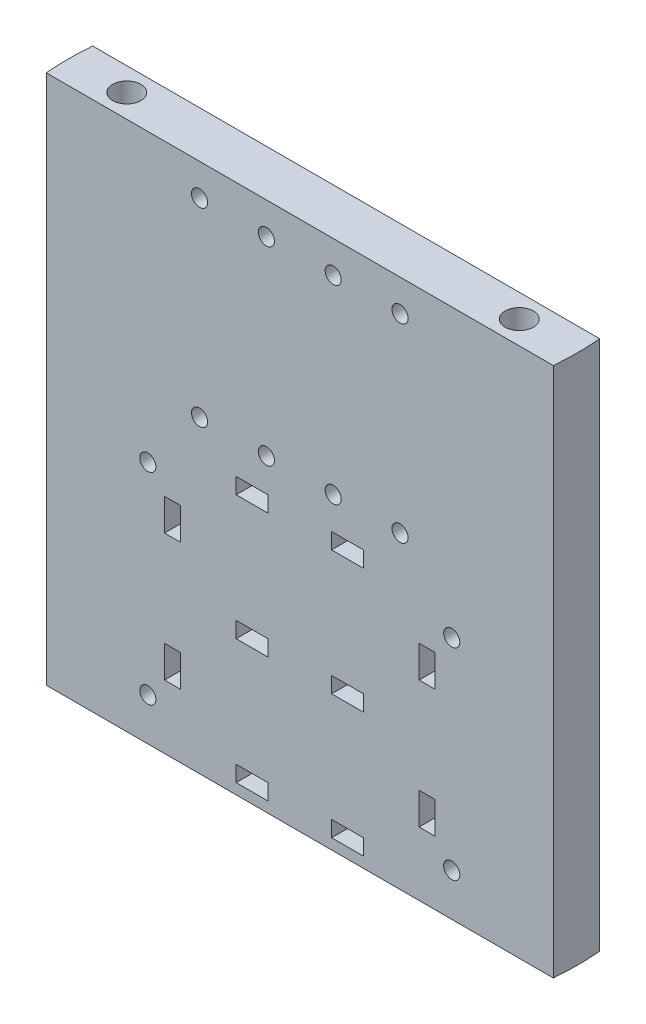
from build123d import *

# Parameters (mm, degrees)
BOSS_EXTRUDE1_DEPTH           = 127
TAP_DRILL_FOR_1_4_HELICOIL1_D = 6.7564
F_8_CLEARANCE_HOLE1_D         = 3.8608
SKETCH19_W                    = 7.62
SKETCH19_H                    = 3.81
SKETCH19_W_2                  = 3.81
SKETCH19_H_2                  = 7.62
CUT_EXTRUDE3_DEPTH            = 142.310771904
F_8_CLEARANCE_HOLE2_D         = 3.8608
F_8_CLEARANCE_HOLE3_D         = 3.8608
SKETCH10_W                    = 64.77
SKETCH10_H                    = 63.5
CUT_EXTRUDE4_DEPTH            = 5.08


with BuildPart() as part:
    # Sketch1 → Boss-Extrude1 (new body)
    with BuildSketch(Plane(origin=(0, 0, 0), x_dir=(1, 0, 0), z_dir=(0, 1, 0))):
        with BuildLine():
            Line((60.706, 5.559061432), (-60.706, 5.559061432))
            ThreePointArc((-60.706, 5.559061432), (-60.96, 0), (-60.706, -5.559061432))
            Line((-60.706, -5.559061432), (60.706, -5.559061432))
            ThreePointArc((60.706, -5.559061432), (60.96, 0), (60.706, 5.559061432))
        make_face()
    extrude(amount=BOSS_EXTRUDE1_DEPTH)

    # Tap Drill for 1/4 Helicoil1 (through all)
    with Locations(Plane(origin=(0, 127, 0), x_dir=(1, 0, 0), z_dir=(0, 1, 0))):
        with Locations((-46.99, 0), (46.99, 0)):
            Hole(TAP_DRILL_FOR_1_4_HELICOIL1_D / 2)

    # #8 Clearance Hole1 (through all)
    with Locations(Plane(origin=(0, 0, -5.559061432), x_dir=(-1, 0, 0), z_dir=(0, 0, -1))):
        with Locations((-8.001, 119.38), (-8.001, 73.914), (8.001, 73.914), (8.001, 119.38)):
            Hole(F_8_CLEARANCE_HOLE1_D / 2)

    # Sketch19 → Cut-Extrude3 (cut, through all)
    with BuildSketch(Plane(origin=(0, 0, -5.559061432), x_dir=(-1, 0, 0), z_dir=(0, 0, -1))):
        with Locations((-11.43, 34.29)):
            Rectangle(SKETCH19_W, SKETCH19_H)
        with Locations((30.48, 49.53)):
            Rectangle(SKETCH19_W_2, SKETCH19_H_2)
        with Locations((-11.43, 64.135)):
            Rectangle(SKETCH19_W, SKETCH19_H)
        with Locations((11.43, 64.135)):
            Rectangle(SKETCH19_W, SKETCH19_H)
        with Locations((-11.43, 4.445)):
            Rectangle(SKETCH19_W, SKETCH19_H)
        with Locations((11.43, 4.445)):
            Rectangle(SKETCH19_W, SKETCH19_H)
        with Locations((-30.48, 49.53)):
            Rectangle(SKETCH19_W_2, SKETCH19_H_2)
        with Locations((30.48, 19.05)):
            Rectangle(SKETCH19_W_2, SKETCH19_H_2)
        with Locations((-30.48, 19.05)):
            Rectangle(SKETCH19_W_2, SKETCH19_H_2)
        with Locations((11.43, 34.29)):
            Rectangle(SKETCH19_W, SKETCH19_H)
    extrude(amount=-CUT_EXTRUDE3_DEPTH, mode=Mode.SUBTRACT)

    # #8 Clearance Hole2 (through all)
    with Locations(Plane(origin=(0, 0, -5.559061432), x_dir=(-1, 0, 0), z_dir=(0, 0, -1))):
        with Locations((-24.003, 119.38), (-24.003, 73.914), (24.003, 73.914), (24.003, 119.38)):
            Hole(F_8_CLEARANCE_HOLE2_D / 2)

    # #8 Clearance Hole3 (through all)
    with Locations(Plane(origin=(0, 0, -5.559061432), x_dir=(-1, 0, 0), z_dir=(0, 0, -1))):
        with Locations((-36.3855, 58.42), (-36.3855, 10.16), (36.3855, 10.16), (36.3855, 58.42)):
            Hole(F_8_CLEARANCE_HOLE3_D / 2)

    # Sketch10 → Cut-Extrude4 (cut)
    with BuildSketch(Plane(origin=(0, 0, -5.559061432), x_dir=(-1, 0, 0), z_dir=(0, 0, -1))):
        with Locations((0, 34.29)):
            Rectangle(SKETCH10_W, SKETCH10_H)
    extrude(amount=-CUT_EXTRUDE4_DEPTH, mode=Mode.SUBTRACT)


solid = part.part
